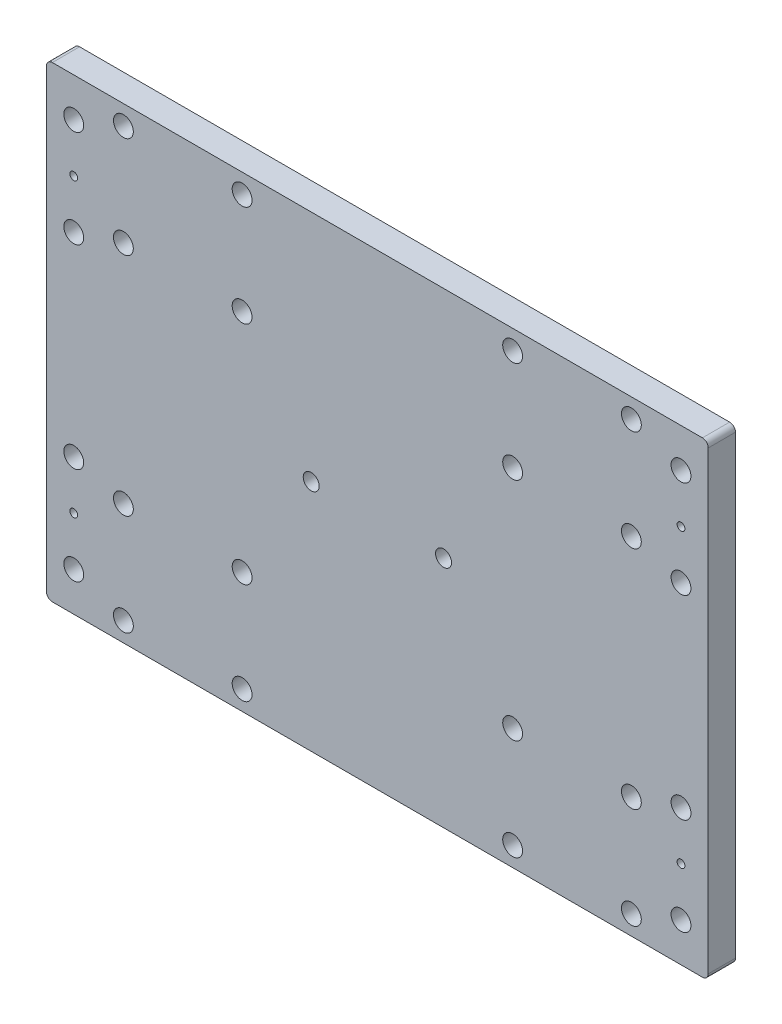
from build123d import *

# Parameters (mm, degrees)
SKETCH1_W           = 170
SKETCH1_H           = 120
BOSS_EXTRUDE1_DEPTH = 3.5
SKETCH2_R           = 2.55
CUT_EXTRUDE1_DEPTH  = 105.27847333
SKETCH4_R           = 2.05
CUT_EXTRUDE3_DEPTH  = 105.27847333
FILLET1_R           = 1.5
SKETCH6_R           = 2.55
SKETCH6_R_2         = 1
CUT_EXTRUDE5_DEPTH  = 105.27847333


with BuildPart() as part:
    # Sketch1 → Boss-Extrude1 (new, symmetric)
    with BuildSketch(Plane.XY):
        Rectangle(SKETCH1_W, SKETCH1_H)
    extrude(amount=BOSS_EXTRUDE1_DEPTH, both=True)

    # Sketch2 → Cut-Extrude1 (cut, through all)
    with BuildSketch(Plane.XY.offset(3.5)):
        with Locations((-65.25, 55)):
            Circle(SKETCH2_R)
        with Locations((-34.75, 55)):
            Circle(SKETCH2_R)
        with Locations((-34.75, 29)):
            Circle(SKETCH2_R)
        with Locations((-65.25, 29)):
            Circle(SKETCH2_R)
        with Locations((65.25, 55)):
            Circle(SKETCH2_R)
        with Locations((65.25, 29)):
            Circle(SKETCH2_R)
        with Locations((34.75, 29)):
            Circle(SKETCH2_R)
        with Locations((34.75, 55)):
            Circle(SKETCH2_R)
        with Locations((-65.25, -29)):
            Circle(SKETCH2_R)
        with Locations((-34.75, -29)):
            Circle(SKETCH2_R)
        with Locations((-34.75, -55)):
            Circle(SKETCH2_R)
        with Locations((-65.25, -55)):
            Circle(SKETCH2_R)
        with Locations((34.75, -29)):
            Circle(SKETCH2_R)
        with Locations((65.25, -29)):
            Circle(SKETCH2_R)
        with Locations((65.25, -55)):
            Circle(SKETCH2_R)
        with Locations((34.75, -55)):
            Circle(SKETCH2_R)
    extrude(amount=-CUT_EXTRUDE1_DEPTH, mode=Mode.SUBTRACT)

    # Sketch4 → Cut-Extrude3 (cut, through all)
    with BuildSketch(Plane.XY.offset(3.5)):
        with Locations((-17, 0)):
            Circle(SKETCH4_R)
        with Locations((17, 0)):
            Circle(SKETCH4_R)
    extrude(amount=-CUT_EXTRUDE3_DEPTH, mode=Mode.SUBTRACT)

    # Fillet1
    fillet1_edges = [part.edges().sort_by_distance(p)[0] for p in [
        (-85, -60, 0),
        (85, -60, 0),
        (85, 60, 0),
        (-85, 60, 0),
    ]]
    fillet(fillet1_edges, radius=FILLET1_R)

    # Sketch6 → Cut-Extrude5 (cut, through all)
    with BuildSketch(Plane.XY.offset(3.5)):
        with Locations((-78, 50)):
            Circle(SKETCH6_R)
        with Locations((-78, 37.5)):
            Circle(SKETCH6_R_2)
        with Locations((-78, 25)):
            Circle(SKETCH6_R)
        with Locations((-78, -25)):
            Circle(SKETCH6_R)
        with Locations((-78, -37.5)):
            Circle(SKETCH6_R_2)
        with Locations((-78, -50)):
            Circle(SKETCH6_R)
    cut_extrude5 = extrude(amount=-CUT_EXTRUDE5_DEPTH, mode=Mode.SUBTRACT)

    # Mirror1: Cut-Extrude5 across plane
    add(cut_extrude5.mirror(Plane(origin=(0, 0, 0), x_dir=(0, 0, 1), z_dir=(1, 0, 0))), mode=Mode.SUBTRACT)


solid = part.part
